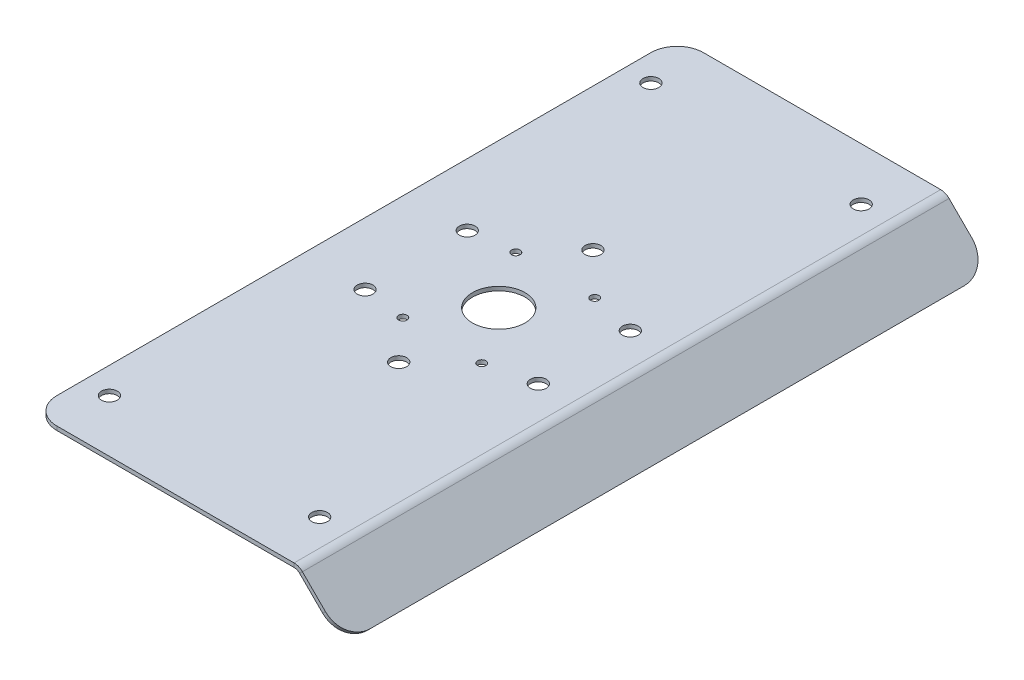
from build123d import *

# Parameters (mm, degrees)
BASE_FLANGE1_DEPTH = 246
FILLET1_R          = 10
SKETCH7_R          = 3
CUT_EXTRUDE1_DEPTH = 1.5
SKETCH8_R          = 10
SKETCH8_R_2        = 1.6
CUT_EXTRUDE2_DEPTH = 1.5
SKETCH9_R          = 3
CUT_EXTRUDE3_DEPTH = 10


# Sheet-metal steps are written as plain solids
with BuildPart() as part:
    # Sketch1 → Base-Flange1 (new body)
    with BuildSketch(Plane.XY):
        with BuildLine():
            Line((-121.208107966, 98), (-20.950748653, 98))
            ThreePointArc((-20.950748653, 98), (-19.802698356, 97.771638598), (-18.829428309, 97.121320344))
            Line((-18.829428309, 97.121320344), (-3, 81.291892034))
            Line((-3, 81.291892034), (-1.939339828, 82.352552206))
            Line((-1.939339828, 82.352552206), (-17.768768137, 98.181980515))
            ThreePointArc((-17.768768137, 98.181980515), (-19.228673207, 99.157457896), (-20.950748653, 99.5))
            Line((-20.950748653, 99.5), (-121.208107966, 99.5))
            Line((-121.208107966, 99.5), (-121.208107966, 98))
        make_face()
    extrude(amount=BASE_FLANGE1_DEPTH)

    # Fillet1
    fillet1_edges = [part.edges().sort_by_distance(p)[0] for p in [
        (-121.208107966, 98.75, 246),
        (-121.208107966, 98.75, 0),
        (-2.469669914, 81.82222212, 246),
        (-2.469669914, 81.82222212, 0),
    ]]
    fillet(fillet1_edges, radius=FILLET1_R)

    # Sketch7 → Cut-Extrude1 (cut)
    with BuildSketch(Plane(origin=(0, 99.5, 0), x_dir=(1, 0, 0), z_dir=(0, 1, 0))):
        with Locations(Location((-111.208107966, -20, 0), (0, 0, 270))):
            Circle(SKETCH7_R)
        with Locations(Location((-31.208107966, -20, 0), (0, 0, 270))):
            Circle(SKETCH7_R)
        with Locations(Location((-31.208107966, -226, 0), (0, 0, 270))):
            Circle(SKETCH7_R)
        with Locations(Location((-111.208107966, -226, 0), (0, 0, 270))):
            Circle(SKETCH7_R)
    extrude(amount=-CUT_EXTRUDE1_DEPTH, mode=Mode.SUBTRACT)

    # Sketch8 → Cut-Extrude2 (cut)
    with BuildSketch(Plane(origin=(0, 99.5, 0), x_dir=(1, 0, 0), z_dir=(0, 1, 0))):
        with Locations(Location((-66.079428309, -123, 0), (0, 0, 270))):
            Circle(SKETCH8_R)
        with Locations(Location((-51.079428309, -101.5, 0), (0, 0, 270))):
            Circle(SKETCH8_R_2)
        with Locations(Location((-81.079428309, -101.5, 0), (0, 0, 270))):
            Circle(SKETCH8_R_2)
        with Locations(Location((-81.079428309, -144.5, 0), (0, 0, 90))):
            Circle(SKETCH8_R_2)
        with Locations(Location((-51.079428309, -144.5, 0), (0, 0, 90))):
            Circle(SKETCH8_R_2)
    extrude(amount=-CUT_EXTRUDE2_DEPTH, mode=Mode.SUBTRACT)

    # Sketch9 → Cut-Extrude3 (cut)
    with BuildSketch(Plane(origin=(0, 99.5, 0), x_dir=(1, 0, 0), z_dir=(0, 1, 0))):
        with Locations(Location((-33.529428309, -105.5, 0), (0, 0, 270))):
            Circle(SKETCH9_R)
        with Locations(Location((-33.529428309, -140.5, 0), (0, 0, 270))):
            Circle(SKETCH9_R)
        with Locations(Location((-67.198983743, -159.939126893, 0), (0, 0, 270))):
            Circle(SKETCH9_R)
        with Locations(Location((-97.509872875, -142.439126893, 0), (0, 0, 270))):
            Circle(SKETCH9_R)
        with Locations(Location((-97.509872875, -103.560873107, 0), (0, 0, 270))):
            Circle(SKETCH9_R)
        with Locations(Location((-67.198983743, -86.060873107, 0), (0, 0, 270))):
            Circle(SKETCH9_R)
    extrude(amount=-CUT_EXTRUDE3_DEPTH, mode=Mode.SUBTRACT)


solid = part.part
